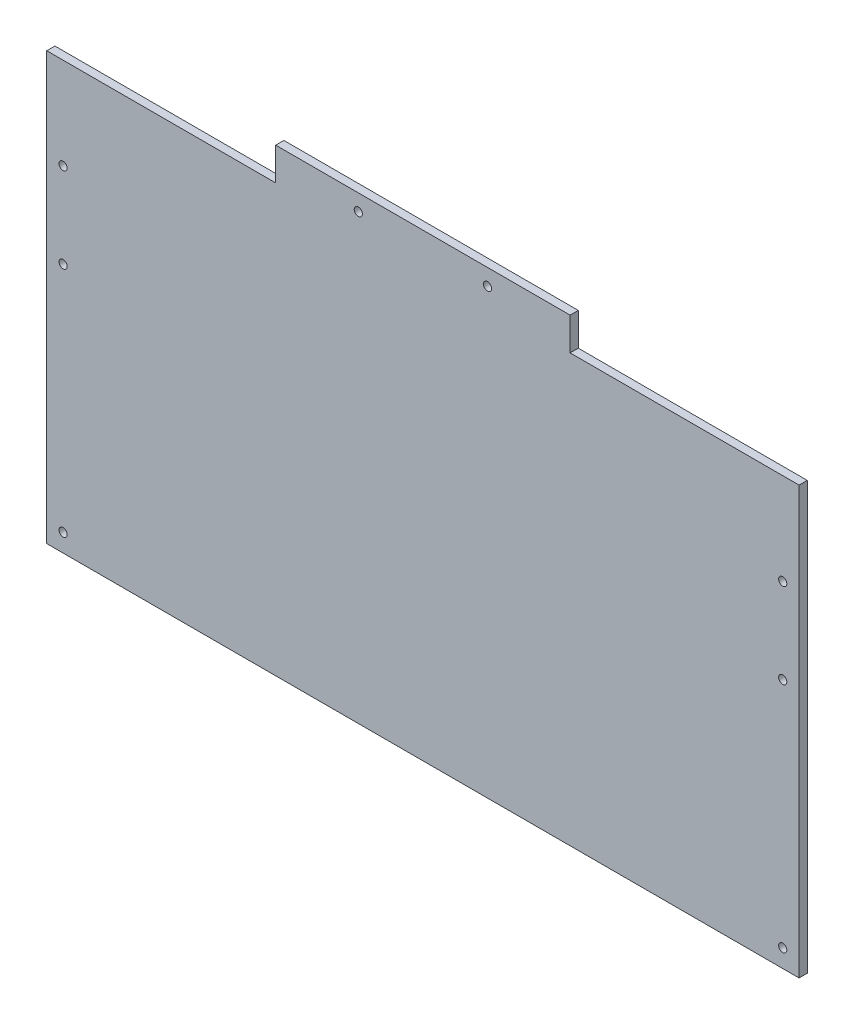
from build123d import *

# Parameters (mm, degrees)
SKETCH_1_W          = 460
SKETCH_1_H          = 261
EXTRUDE_1_DEPTH     = 5
SKETCH_2_R          = 2.5
CUT_EXTRUDE_1_DEPTH = 265.490548035
SKETCH_3_R          = 2.5
EXTRUDE_2_DEPTH     = 5


with BuildPart() as part:
    # 스케치1 → 보스-돌출1 (new body)
    with BuildSketch(Plane.XY):
        Rectangle(SKETCH_1_W, SKETCH_1_H)
    extrude(amount=EXTRUDE_1_DEPTH)

    # 스케치2 → 컷-돌출1 (cut, through all)
    with BuildSketch(Plane.XY.offset(5)):
        with Locations((220, 74.5)):
            Circle(SKETCH_2_R)
        with Locations((220, 22.5)):
            Circle(SKETCH_2_R)
        with Locations((220, -119.5)):
            Circle(SKETCH_2_R)
        with Locations((-220, 74.5)):
            Circle(SKETCH_2_R)
        with Locations((-220, 22.5)):
            Circle(SKETCH_2_R)
        with Locations((-220, -119.5)):
            Circle(SKETCH_2_R)
    extrude(amount=-CUT_EXTRUDE_1_DEPTH, mode=Mode.SUBTRACT)

    # 스케치3 → 보스-돌출2 (add)
    with BuildSketch(Plane.XY.offset(5)):
        Polygon((90, 130.5), (90, 150.5), (-90, 150.5), (-90, 130.5), (-90, 112.107396195), (90, 112.107396195), align=None)
        with Locations((-39.5, 140.5)):
            Circle(SKETCH_3_R, mode=Mode.SUBTRACT)
        with Locations((39.5, 140.5)):
            Circle(SKETCH_3_R, mode=Mode.SUBTRACT)
    extrude(amount=-EXTRUDE_2_DEPTH)


solid = part.part
